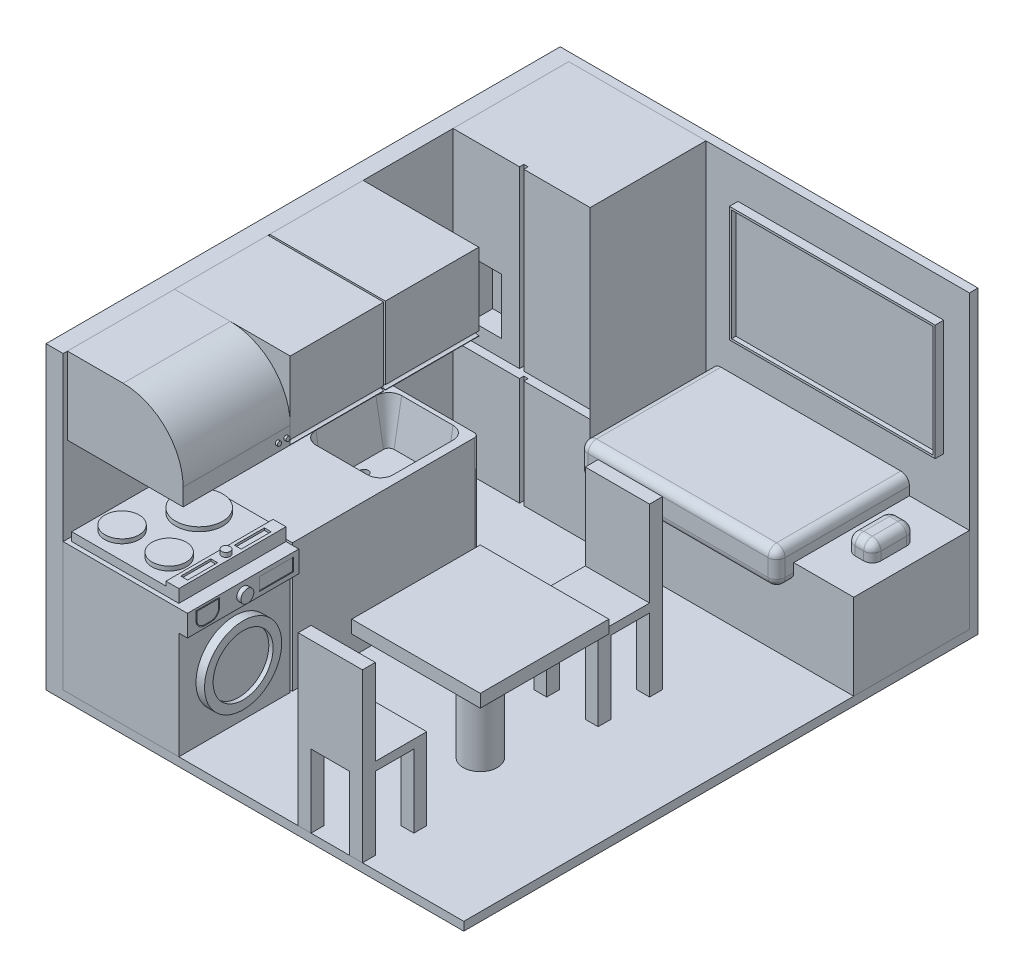
from build123d import *

# Parameters (mm, degrees)
SKETCH_2_W           = 97.5
SKETCH_2_H           = 120
EXTRUDE_2_DEPTH      = 2
SKETCH_3_W           = 97.5
SKETCH_3_H           = 2
EXTRUDE_3_DEPTH      = 68
SKETCH_7_W           = 4
SKETCH_7_H           = 118
EXTRUDE_6_DEPTH      = 68
SKETCH_8_W           = 30.5
SKETCH_8_H           = 30.5
CUT_EXTRUDE_1_DEPTH  = 2
SKETCH_9_W           = 27
SKETCH_9_H           = 70
EXTRUDE_7_DEPTH      = 30
SKETCH_10_W          = 25
SKETCH_10_H          = 25
EXTRUDE_8_DEPTH      = 2
SKETCH_11_W          = 3
SKETCH_11_H          = 25
EXTRUDE_9_DEPTH      = 1
SKETCH_12_R          = 4
SKETCH_12_R_2        = 5.5
EXTRUDE_10_DEPTH     = 1
SKETCH_13_R          = 1
EXTRUDE_11_DEPTH     = 1
SKETCH_14_W          = 1.6
SKETCH_14_H          = 7
CUT_EXTRUDE_2_DEPTH  = 0.5
CUT_EXTRUDE_3_DEPTH  = 10
CUT_EXTRUDE_3_DRAFT  = -10
SKETCH_16_R          = 1
CUT_EXTRUDE_4_DEPTH  = 10
SKETCH_18_R          = 1.25
EXTRUDE_15_DEPTH     = 1
SKETCH_24_R          = 1.25
SHELL_1_OUTLINE_R    = 0.75
SHELL_1_ANGLE        = 180
SHELL_START          = 32.5
SHELL_1_2_OUTLINE_R  = 0.75
SHELL_1_2_DEPTH      = 7.75
SKETCH_28_R          = 0.75
EXTRUDE_17_DEPTH     = 2
SKETCH_29_W          = 2
SKETCH_29_H          = 0.83835269
EXTRUDE_18_DEPTH     = 0.2
SKETCH_30_R          = 0.75
EXTRUDE_19_DEPTH     = 0.5
SKETCH_33_W          = 27
SKETCH_33_H          = 25
EXTRUDE_21_DEPTH     = 18
FILLET_3_R           = 14
SKETCH_34_R          = 0.5
EXTRUDE_22_DEPTH     = 0.5
SKETCH_35_W          = 27
SKETCH_35_H          = 44
EXTRUDE_23_DEPTH     = 18
CUT_EXTRUDE_6_DEPTH  = 44
SKETCH_37_W          = 0.4
SKETCH_37_H          = 18
CUT_EXTRUDE_10_DEPTH = 27
SKETCH_40_W          = 0.5
SKETCH_40_H          = 30
CUT_EXTRUDE_11_DEPTH = 27
SKETCH_41_R          = 9
EXTRUDE_25_DEPTH     = 2
SKETCH_42_R          = 7
CUT_EXTRUDE_12_DEPTH = 1
SKETCH_43_W          = 26
SKETCH_43_H          = 5
EXTRUDE_26_DEPTH     = 2
CUT_EXTRUDE_13_DEPTH = 1
SKETCH_45_R          = 1.5
EXTRUDE_27_DEPTH     = 1
SKETCH_46_W          = 7.948915111
SKETCH_46_H          = 3
CUT_EXTRUDE_14_DEPTH = 0.2
SKETCH_47_R          = 4
EXTRUDE_28_DEPTH     = 25
SKETCH_48_W          = 30
SKETCH_48_H          = 30
EXTRUDE_29_DEPTH     = 3
SKETCH_49_W          = 3
SKETCH_49_H          = 3
EXTRUDE_30_DEPTH     = 17
EXTRUDE_30_2_DEPTH   = 17
EXTRUDE_30_3_DEPTH   = 17
EXTRUDE_30_4_DEPTH   = 17
SKETCH_50_W          = 15
SKETCH_50_H          = 15
EXTRUDE_31_DEPTH     = 2
SKETCH_51_W          = 15
SKETCH_51_H          = 3
EXTRUDE_32_DEPTH     = 20
FILLET_4_R           = 1
SKETCH_53_W          = 60
SKETCH_53_H          = 27
EXTRUDE_33_DEPTH     = 20
SKETCH_54_W          = 6
SKETCH_54_H          = 10
EXTRUDE_34_DEPTH     = 4
FILLET_5_R           = 2
FILLET_6_R           = 2
FILLET_7_R           = 2
FILLET_8_R           = 2
SKETCH_55_W          = 46
SKETCH_55_H          = 31
EXTRUDE_35_DEPTH     = 4
SKETCH_56_W          = 46
SKETCH_56_H          = 4
EXTRUDE_36_DEPTH     = 4
FILLET_9_R           = 2
FILLET_10_R          = 2
FILLET_11_R          = 2
FILLET_12_R          = 2
SKETCH_57_W          = 48
SKETCH_57_H          = 27
EXTRUDE_37_DEPTH     = 2
SKETCH_58_W          = 47
SKETCH_58_H          = 26
CUT_EXTRUDE_15_DEPTH = 1
SKETCH_59_W          = 32
SKETCH_59_H          = 68
EXTRUDE_38_DEPTH     = 27
SKETCH_61_W          = 1
SKETCH_61_H          = 68
CUT_EXTRUDE_16_DEPTH = 1
SKETCH_64_W          = 31.9
SKETCH_64_H          = 2
CUT_EXTRUDE_23_DEPTH = 10
SKETCH_65_W          = 7
SKETCH_65_H          = 13
CUT_EXTRUDE_24_DEPTH = 5


with BuildPart() as part:
    # 스케치2 → 보스-돌출2 (new body)
    with BuildSketch(Plane(origin=(0, 0, 0), x_dir=(1, 0, 0), z_dir=(0, 1, 0))):
        Rectangle(SKETCH_2_W, SKETCH_2_H)
    extrude(amount=EXTRUDE_2_DEPTH)

    # 스케치3 → 보스-돌출3 (add)
    with BuildSketch(Plane(origin=(0, 2, 0), x_dir=(1, 0, 0), z_dir=(0, 1, 0))):
        with Locations((0, 59)):
            Rectangle(SKETCH_3_W, SKETCH_3_H)
    extrude(amount=EXTRUDE_3_DEPTH)

    # 스케치7 → 보스-돌출6 (add)
    with BuildSketch(Plane(origin=(0, 2, 0), x_dir=(1, 0, 0), z_dir=(0, 1, 0))):
        with Locations((-46.75, -1)):
            Rectangle(SKETCH_7_W, SKETCH_7_H)
    extrude(amount=EXTRUDE_6_DEPTH)

    # 스케치8 → 컷-돌출1 (cut)
    with BuildSketch(Plane.ZY.offset(48.75)):
        with Locations((0, 16.25)):
            Rectangle(SKETCH_8_W, SKETCH_8_H)
    extrude(amount=-CUT_EXTRUDE_1_DEPTH, mode=Mode.SUBTRACT)


with BuildPart() as body_2:
    # 스케치9 → 보스-돌출7 (new body)
    with BuildSketch(Plane(origin=(0, 2, 0), x_dir=(1, 0, 0), z_dir=(0, 1, 0))):
        with Locations((-31.25, -25)):
            Rectangle(SKETCH_9_W, SKETCH_9_H)
    extrude(amount=EXTRUDE_7_DEPTH)


with BuildPart() as body_3:
    # 스케치10 → 보스-돌출8 (new body)
    with BuildSketch(Plane(origin=(0, 32, 0), x_dir=(1, 0, 0), z_dir=(0, 1, 0))):
        with Locations((-31.25, -46.5)):
            Rectangle(SKETCH_10_W, SKETCH_10_H)
    extrude(amount=EXTRUDE_8_DEPTH)

    # 스케치11 → 보스-돌출9 (add)
    with BuildSketch(Plane(origin=(0, 34, 0), x_dir=(1, 0, 0), z_dir=(0, 1, 0))):
        with Locations((-20.25, -46.5)):
            Rectangle(SKETCH_11_W, SKETCH_11_H)
    extrude(amount=EXTRUDE_9_DEPTH)

    # 스케치12 → 보스-돌출10 (add)
    with BuildSketch(Plane(origin=(0, 34, 0), x_dir=(1, 0, 0), z_dir=(0, 1, 0))):
        with Locations(Location((-38.25, -52.75, 0), (0, 0, 270))):
            Circle(SKETCH_12_R)
        with Locations(Location((-27.25, -52.75, 0), (0, 0, 270))):
            Circle(SKETCH_12_R)
        with Locations(Location((-32.75, -40.25, 0), (0, 0, 270))):
            Circle(SKETCH_12_R_2)
    extrude(amount=EXTRUDE_10_DEPTH)

    # 스케치13 → 보스-돌출11 (add)
    with BuildSketch(Plane(origin=(0, 35, 0), x_dir=(1, 0, 0), z_dir=(0, 1, 0))):
        with Locations(Location((-20.25, -46.5, 0), (0, 0, 90))):
            Circle(SKETCH_13_R)
    extrude(amount=EXTRUDE_11_DEPTH)

    # 스케치14 → 컷-돌출2 (cut)
    with BuildSketch(Plane(origin=(0, 35, 0), x_dir=(1, 0, 0), z_dir=(0, 1, 0))):
        with Locations((-20.25, -52.75)):
            Rectangle(SKETCH_14_W, SKETCH_14_H)
        with Locations((-20.25, -40.25)):
            Rectangle(SKETCH_14_W, SKETCH_14_H)
    extrude(amount=-CUT_EXTRUDE_2_DEPTH, mode=Mode.SUBTRACT)


with BuildPart() as cut_extrude_3_tool:
    # 스케치15 → 컷-돌출3 (with draft: the straight prism first)
    with BuildSketch(Plane(origin=(0, 32, 0), x_dir=(1, 0, 0), z_dir=(0, 1, 0))):
        with BuildLine():
            Line((-34.75, -11), (-22.75, -11))
            ThreePointArc((-22.75, -11), (-20.628679656, -10.121320344), (-19.75, -8))
            Line((-19.75, -8), (-19.75, 6))
            ThreePointArc((-19.75, 6), (-20.628679656, 8.121320344), (-22.75, 9))
            Line((-22.75, 9), (-34.75, 9))
            ThreePointArc((-34.75, 9), (-36.871320344, 8.121320344), (-37.75, 6))
            Line((-37.75, 6), (-37.75, -8))
            ThreePointArc((-37.75, -8), (-36.871320344, -10.121320344), (-34.75, -11))
        make_face()
    extrude(amount=-CUT_EXTRUDE_3_DEPTH)
    # 컷-돌출3: the draft: its side faces are tilted about the plane it starts from
    cut_extrude_3_sides = [cut_extrude_3_tool.faces().sort_by_distance(p)[0] for p in [
        (-28.75, 27, 11),
        (-20.628679656, 27, 10.121320344),
        (-19.75, 27, 1),
        (-20.628679656, 27, -8.121320344),
        (-28.75, 27, -9),
        (-36.871320344, 27, -8.121320344),
        (-37.75, 27, 1),
        (-36.871320344, 27, 10.121320344),
    ]]
    draft(cut_extrude_3_sides, Plane(origin=(0, 32, 0), x_dir=(1, 0, 0), z_dir=(0, 1, 0)), CUT_EXTRUDE_3_DRAFT)


with BuildPart() as body_2_1:
    add(body_2.part)

    # 컷-돌출3: cut by cut_extrude_3_tool
    add(cut_extrude_3_tool.part, mode=Mode.SUBTRACT)

    # 스케치16 → 컷-돌출4 (cut)
    with BuildSketch(Plane(origin=(0, 22, 0), x_dir=(1, 0, 0), z_dir=(0, 1, 0))):
        with Locations(Location((-33.513269807, -1, 0), (0, 0, 270))):
            Circle(SKETCH_16_R)
    extrude(amount=-CUT_EXTRUDE_4_DEPTH, mode=Mode.SUBTRACT)

    # 스케치40 → 컷-돌출11 (cut)
    with BuildSketch(Plane(origin=(-17.75, 0, 0), x_dir=(0, 0, -1), z_dir=(1, 0, 0))):
        with Locations((-33.75, 17)):
            Rectangle(SKETCH_40_W, SKETCH_40_H)
    extrude(amount=-CUT_EXTRUDE_11_DEPTH, mode=Mode.SUBTRACT)


with BuildPart() as body_4:
    # 스케치18 → 보스-돌출15 (new body)
    with BuildSketch(Plane(origin=(0, 32, 0), x_dir=(1, 0, 0), z_dir=(0, 1, 0))):
        with Locations(Location((-42.75, -1, 0), (0, 0, 270))):
            Circle(SKETCH_18_R)
    extrude(amount=EXTRUDE_15_DEPTH)

    # 스윕2: sweep along a path in 스케치25
    with BuildLine(Plane(origin=(0, 0, 1), x_dir=(-1, 0, 0), z_dir=(0, 0, -1))) as sweep_2_path:
        Line((42.75, 33), (42.75, 40.25))
        ThreePointArc((42.75, 40.25), (37.75, 45.25), (32.75, 40.25))
    # 스케치24 → 스윕2 (sweep)
    with BuildSketch(Plane(origin=(0, 33, 0), x_dir=(1, 0, 0), z_dir=(0, 1, 0))):
        with Locations((-42.75, -1)):
            Circle(SKETCH_24_R)
    sweep(path=sweep_2_path.line)

    # 쉘1: read off the stored shape, not the designer's step
    # 쉘1 outline → 쉘1 (revolve, cut)
    with BuildSketch(Plane(origin=(-37.75, 40.25, 0), x_dir=(1, 0, 0), z_dir=(0, -1, 0))):
        with Locations((5, 1)):
            Circle(SHELL_1_OUTLINE_R)
    revolve(axis=Axis((-37.75, 40.25, 0), (0, 0, 1)), revolution_arc=SHELL_1_ANGLE, mode=Mode.SUBTRACT)

    # Shell 1 2 outline → Shell 1 2 (cut)
    with BuildSketch(Plane(origin=(0, 0, 0), x_dir=(1, 0, 0), z_dir=(0, 1, 0)).offset(SHELL_START)):
        with Locations((-42.75, -1)):
            Circle(SHELL_1_2_OUTLINE_R)
    extrude(amount=SHELL_1_2_DEPTH, mode=Mode.SUBTRACT)


with BuildPart() as body_5:
    # 스케치28 → 보스-돌출17 (new body)
    with BuildSketch(Plane(origin=(0, 32, 0), x_dir=(1, 0, 0), z_dir=(0, 1, 0))):
        with Locations(Location((-41.25, 4.25, 0), (0, 0, 270))):
            Circle(SKETCH_28_R)
    extrude(amount=EXTRUDE_17_DEPTH)

    # 스케치29 → 보스-돌출18 (add)
    with BuildSketch(Plane(origin=(0, 34, 0), x_dir=(1, 0, 0), z_dir=(0, 1, 0))):
        with Locations((-40.25, 4.25)):
            Rectangle(SKETCH_29_W, SKETCH_29_H)
    extrude(amount=EXTRUDE_18_DEPTH)

    # 스케치30 → 보스-돌출19 (add)
    with BuildSketch(Plane(origin=(0, 34, 0), x_dir=(1, 0, 0), z_dir=(0, 1, 0))):
        with Locations(Location((-41.25, 4.25, 0), (0, 0, 270))):
            Circle(SKETCH_30_R)
    extrude(amount=EXTRUDE_19_DEPTH)


with BuildPart() as body_6:
    # 스케치33 → 보스-돌출21 (new body)
    with BuildSketch(Plane(origin=(0, 52, 0), x_dir=(1, 0, 0), z_dir=(0, 1, 0))):
        with Locations((-31.25, -46.5)):
            Rectangle(SKETCH_33_W, SKETCH_33_H)
    extrude(amount=EXTRUDE_21_DEPTH)

    # 필렛3
    fillet_3_edges = [body_6.edges().sort_by_distance(p)[0] for p in [
        (-17.75, 70, 46.5),
    ]]
    fillet(fillet_3_edges, radius=FILLET_3_R)

    # 스케치34 → 보스-돌출22 (add)
    with BuildSketch(Plane(origin=(-17.75, 0, 0), x_dir=(0, 0, -1), z_dir=(1, 0, 0))):
        with Locations(Location((-35, 54, 0), (0, 0, 180))):
            Circle(SKETCH_34_R)
        with Locations(Location((-37, 54, 0), (0, 0, 180))):
            Circle(SKETCH_34_R)
    extrude(amount=EXTRUDE_22_DEPTH)


with BuildPart() as body_7:
    # 스케치35 → 보스-돌출23 (new body)
    with BuildSketch(Plane(origin=(0, 52, 0), x_dir=(1, 0, 0), z_dir=(0, 1, 0))):
        with Locations((-31.25, -12)):
            Rectangle(SKETCH_35_W, SKETCH_35_H)
    extrude(amount=EXTRUDE_23_DEPTH)

    # 스케치36 → 컷-돌출6 (cut)
    with BuildSketch(Plane(origin=(0, 0, -10), x_dir=(-1, 0, 0), z_dir=(0, 0, -1))):
        with BuildLine():
            Line((18.75, 53.1), (17.75, 53.1))
            Line((17.75, 53.1), (17.75, 52.1))
            ThreePointArc((17.75, 52.1), (18.457106781, 52.392893219), (18.75, 53.1))
        make_face()
    extrude(amount=-CUT_EXTRUDE_6_DEPTH, mode=Mode.SUBTRACT)

    # 스케치37 → 컷-돌출10 (cut)
    with BuildSketch(Plane(origin=(-17.75, 0, 0), x_dir=(0, 0, -1), z_dir=(1, 0, 0))):
        with Locations((-12, 61)):
            Rectangle(SKETCH_37_W, SKETCH_37_H)
    extrude(amount=-CUT_EXTRUDE_10_DEPTH, mode=Mode.SUBTRACT)


with BuildPart() as cut_extrude_10_piece_1:
    # of the separate pieces the step leaves, piece 1, a body of its own (cut_extrude_10_pieces)
    add(body_7.part.solids().sort_by_distance((-17.75, 52, -10))[0])


with BuildPart() as cut_extrude_10_piece_2:
    # of the separate pieces the step leaves, piece 2, a body of its own (cut_extrude_10_pieces)
    add(body_7.part.solids().sort_by_distance((-17.75, 52, 34))[0])


with BuildPart() as cut_extrude_11_piece_1:
    # of the separate pieces the step leaves, piece 1, a body of its own (cut_extrude_11_pieces)
    add(body_2_1.part.solids().sort_by_distance((-44.75, 2, -10))[0])

    # 필렛4
    fillet_4_edges = [cut_extrude_11_piece_1.edges().sort_by_distance(p)[0] for p in [
        (-17.75, 17, -10),
    ]]
    fillet(fillet_4_edges, radius=FILLET_4_R)


with BuildPart() as cut_extrude_11_piece_2:
    # of the separate pieces the step leaves, piece 2, a body of its own (cut_extrude_11_pieces)
    add(body_2_1.part.solids().sort_by_distance((-44.75, 2, 60))[0])

    # 스케치41 → 보스-돌출25 (add)
    with BuildSketch(Plane(origin=(-17.75, 0, 0), x_dir=(0, 0, -1), z_dir=(1, 0, 0))):
        with Locations((-47, 15)):
            Circle(SKETCH_41_R)
    extrude(amount=EXTRUDE_25_DEPTH)

    # 스케치42 → 컷-돌출12 (cut)
    with BuildSketch(Plane(origin=(-15.75, 0, 0), x_dir=(0, 0, -1), z_dir=(1, 0, 0))):
        with Locations((-47, 15)):
            Circle(SKETCH_42_R)
    extrude(amount=-CUT_EXTRUDE_12_DEPTH, mode=Mode.SUBTRACT)

    # 스케치43 → 보스-돌출26 (add)
    with BuildSketch(Plane(origin=(-17.75, 0, 0), x_dir=(0, 0, -1), z_dir=(1, 0, 0))):
        with Locations((-47, 29.5)):
            Rectangle(SKETCH_43_W, SKETCH_43_H)
    extrude(amount=EXTRUDE_26_DEPTH)

    # 스케치44 → 컷-돌출13 (cut)
    with BuildSketch(Plane(origin=(-15.75, 0, 0), x_dir=(0, 0, -1), z_dir=(1, 0, 0))):
        with BuildLine():
            Line((-58, 31.5), (-52.5, 31.5))
            Line((-52.5, 31.5), (-52.5, 29.5))
            ThreePointArc((-52.5, 29.5), (-53.085786438, 28.085786438), (-54.5, 27.5))
            Line((-54.5, 27.5), (-56, 27.5))
            ThreePointArc((-56, 27.5), (-57.414213562, 28.085786438), (-58, 29.5))
            Line((-58, 29.5), (-58, 31.5))
        make_face()
        with BuildLine():
            Line((-57.8, 31.3), (-52.7, 31.3))
            Line((-52.7, 31.3), (-52.7, 29.5))
            ThreePointArc((-52.7, 29.5), (-53.227207794, 28.227207794), (-54.5, 27.7))
            Line((-54.5, 27.7), (-56, 27.7))
            ThreePointArc((-56, 27.7), (-57.272792206, 28.227207794), (-57.8, 29.5))
            Line((-57.8, 29.5), (-57.8, 31.3))
        make_face(mode=Mode.SUBTRACT)
    extrude(amount=-CUT_EXTRUDE_13_DEPTH, mode=Mode.SUBTRACT)

    # 스케치45 → 보스-돌출27 (add)
    with BuildSketch(Plane(origin=(-15.75, 0, 0), x_dir=(0, 0, -1), z_dir=(1, 0, 0))):
        with Locations((-47, 29.5)):
            Circle(SKETCH_45_R)
    extrude(amount=EXTRUDE_27_DEPTH)

    # 스케치46 → 컷-돌출14 (cut)
    with BuildSketch(Plane(origin=(-15.75, 0, 0), x_dir=(0, 0, -1), z_dir=(1, 0, 0))):
        with Locations((-39.222820622, 29.5)):
            Rectangle(SKETCH_46_W, SKETCH_46_H)
    extrude(amount=-CUT_EXTRUDE_14_DEPTH, mode=Mode.SUBTRACT)


with BuildPart() as body_10:
    # 스케치47 → 보스-돌출28 (new body)
    with BuildSketch(Plane(origin=(0, 2, 0), x_dir=(1, 0, 0), z_dir=(0, 1, 0))):
        with Locations(Location((17.601601139, -25, 0), (0, 0, 270))):
            Circle(SKETCH_47_R)
    extrude(amount=EXTRUDE_28_DEPTH)

    # 스케치48 → 보스-돌출29 (add)
    with BuildSketch(Plane(origin=(0, 27, 0), x_dir=(1, 0, 0), z_dir=(0, 1, 0))):
        with Locations((17.601601139, -25)):
            Rectangle(SKETCH_48_W, SKETCH_48_H)
    extrude(amount=EXTRUDE_29_DEPTH)


with BuildPart() as body_11:
    # 스케치49 → 보스-돌출30 (new body)
    with BuildSketch(Plane(origin=(0, 2, 0), x_dir=(1, 0, 0), z_dir=(0, 1, 0))):
        with Locations((11.601601139, -46.5)):
            Rectangle(SKETCH_49_W, SKETCH_49_H)
    extrude(amount=EXTRUDE_30_DEPTH)



with BuildPart() as body_12:
    # 스케치49 → Extrude 30 2 (new body)
    with BuildSketch(Plane(origin=(0, 2, 0), x_dir=(1, 0, 0), z_dir=(0, 1, 0))):
        with Locations((23.601601139, -46.5)):
            Rectangle(SKETCH_49_W, SKETCH_49_H)
    extrude(amount=EXTRUDE_30_2_DEPTH)


with BuildPart() as body_13:
    # 스케치49 → Extrude 30 3 (new body)
    with BuildSketch(Plane(origin=(0, 2, 0), x_dir=(1, 0, 0), z_dir=(0, 1, 0))):
        with Locations((23.601601139, -58.5)):
            Rectangle(SKETCH_49_W, SKETCH_49_H)
    extrude(amount=EXTRUDE_30_3_DEPTH)


with BuildPart() as body_14:
    # 스케치49 → Extrude 30 4 (new body)
    with BuildSketch(Plane(origin=(0, 2, 0), x_dir=(1, 0, 0), z_dir=(0, 1, 0))):
        with Locations((11.601601139, -58.5)):
            Rectangle(SKETCH_49_W, SKETCH_49_H)
    extrude(amount=EXTRUDE_30_4_DEPTH)


with BuildPart() as body_11_1:
    add(body_11.part)

    add(body_12.part)  # 보스-돌출31 merges body 12

    add(body_13.part)  # 보스-돌출31 merges body 13

    add(body_14.part)  # 보스-돌출31 merges body 14
    # 스케치50 → 보스-돌출31 (add)
    with BuildSketch(Plane(origin=(0, 19, 0), x_dir=(1, 0, 0), z_dir=(0, 1, 0))):
        with Locations((17.601601139, -52.5)):
            Rectangle(SKETCH_50_W, SKETCH_50_H)
    extrude(amount=EXTRUDE_31_DEPTH)

    # 스케치51 → 보스-돌출32 (add)
    with BuildSketch(Plane(origin=(0, 21, 0), x_dir=(1, 0, 0), z_dir=(0, 1, 0))):
        with Locations((17.601601139, -58.5)):
            Rectangle(SKETCH_51_W, SKETCH_51_H)
    extrude(amount=EXTRUDE_32_DEPTH)


with BuildPart() as body_12_2:
    # 대칭 복사1: mirrored copy
    add(body_11_1.part.mirror(Plane.XY.offset(25)))


with BuildPart() as body_13_2:
    # 스케치53 → 보스-돌출33 (new body)
    with BuildSketch(Plane(origin=(0, 2, 0), x_dir=(1, 0, 0), z_dir=(0, 1, 0))):
        with Locations((18.75, 44.5)):
            Rectangle(SKETCH_53_W, SKETCH_53_H)
    extrude(amount=EXTRUDE_33_DEPTH)


with BuildPart() as body_14_2:
    # 스케치54 → 보스-돌출34 (new body)
    with BuildSketch(Plane(origin=(0, 22, 0), x_dir=(1, 0, 0), z_dir=(0, 1, 0))):
        with Locations((41.583180834, 44.5)):
            Rectangle(SKETCH_54_W, SKETCH_54_H)
    extrude(amount=EXTRUDE_34_DEPTH)

    # 필렛5
    fillet_5_edges = [body_14_2.edges().sort_by_distance(p)[0] for p in [
        (38.583180834, 26, -44.5),
    ]]
    fillet(fillet_5_edges, radius=FILLET_5_R)

    # 필렛6
    fillet_6_edges = [body_14_2.edges().sort_by_distance(p)[0] for p in [
        (44.583180834, 26, -44.5),
    ]]
    fillet(fillet_6_edges, radius=FILLET_6_R)

    # 필렛7
    fillet_7_edges = [body_14_2.edges().sort_by_distance(p)[0] for p in [
        (41.583180834, 26, -39.5),
        (38.583180834, 23, -39.5),
        (39.168967271, 25.414213562, -39.5),
        (44.583180834, 23, -39.5),
        (43.997394396, 25.414213562, -39.5),
    ]]
    fillet(fillet_7_edges, radius=FILLET_7_R)

    # 필렛8
    fillet_8_edges = [body_14_2.edges().sort_by_distance(p)[0] for p in [
        (38.583180834, 23, -49.5),
        (39.168967271, 25.414213562, -49.5),
        (41.583180834, 26, -49.5),
        (44.583180834, 23, -49.5),
        (43.997394396, 25.414213562, -49.5),
    ]]
    fillet(fillet_8_edges, radius=FILLET_8_R)


with BuildPart() as body_15:
    # 스케치55 → 보스-돌출35 (new body)
    with BuildSketch(Plane(origin=(0, 22, 0), x_dir=(1, 0, 0), z_dir=(0, 1, 0))):
        with Locations((11.75, 42.5)):
            Rectangle(SKETCH_55_W, SKETCH_55_H)
    extrude(amount=EXTRUDE_35_DEPTH)

    # 스케치56 → 보스-돌출36 (add)
    with BuildSketch(Plane.XZ.offset(-22)):
        with Locations((11.75, -29)):
            Rectangle(SKETCH_56_W, SKETCH_56_H)
    extrude(amount=EXTRUDE_36_DEPTH)

    # 필렛9
    fillet_9_edges = [body_15.edges().sort_by_distance(p)[0] for p in [
        (11.75, 26, -27),
    ]]
    fillet(fillet_9_edges, radius=FILLET_9_R)

    # 필렛10
    fillet_10_edges = [body_15.edges().sort_by_distance(p)[0] for p in [
        (11.75, 18, -27),
    ]]
    fillet(fillet_10_edges, radius=FILLET_10_R)

    # 필렛11
    fillet_11_edges = [body_15.edges().sort_by_distance(p)[0] for p in [
        (34.75, 18, -30),
        (34.75, 22, -27),
        (34.75, 26, -43.5),
        (34.75, 25.414213562, -27.585786438),
        (34.75, 18.585786438, -27.585786438),
    ]]
    fillet(fillet_11_edges, radius=FILLET_11_R)

    # 필렛12
    fillet_12_edges = [body_15.edges().sort_by_distance(p)[0] for p in [
        (-11.25, 22, -27),
        (-11.25, 25.414213562, -27.585786438),
        (-11.25, 18, -30),
        (-11.25, 18.585786438, -27.585786438),
        (-11.25, 26, -43.5),
    ]]
    fillet(fillet_12_edges, radius=FILLET_12_R)


with BuildPart() as body_16:
    # 스케치57 → 보스-돌출37 (new body)
    with BuildSketch(Plane.XY.offset(-58)):
        with Locations((18.75, 48)):
            Rectangle(SKETCH_57_W, SKETCH_57_H)
    extrude(amount=EXTRUDE_37_DEPTH)

    # 스케치58 → 컷-돌출15 (cut)
    with BuildSketch(Plane.XY.offset(-56)):
        with Locations((18.75, 48)):
            Rectangle(SKETCH_58_W, SKETCH_58_H)
    extrude(amount=-CUT_EXTRUDE_15_DEPTH, mode=Mode.SUBTRACT)


with BuildPart() as body_17:
    # 스케치59 → 보스-돌출38 (new body)
    with BuildSketch(Plane.XY.offset(-58)):
        with Locations((-28.75, 36)):
            Rectangle(SKETCH_59_W, SKETCH_59_H)
    extrude(amount=EXTRUDE_38_DEPTH)

    # 스케치61 → 컷-돌출16 (cut)
    with BuildSketch(Plane.XY.offset(-31)):
        with Locations((-28.75, 36)):
            Rectangle(SKETCH_61_W, SKETCH_61_H)
    extrude(amount=-CUT_EXTRUDE_16_DEPTH, mode=Mode.SUBTRACT)

    # 스케치64 → 컷-돌출23 (cut)
    with BuildSketch(Plane.XY.offset(-31)):
        with Locations((-28.8, 28.192416579)):
            Rectangle(SKETCH_64_W, SKETCH_64_H)
    extrude(amount=-CUT_EXTRUDE_23_DEPTH, mode=Mode.SUBTRACT)

    # 스케치65 → 컷-돌출24 (cut)
    with BuildSketch(Plane.XY.offset(-31)):
        with Locations((-37, 39.692416579)):
            Rectangle(SKETCH_65_W, SKETCH_65_H)
    extrude(amount=-CUT_EXTRUDE_24_DEPTH, mode=Mode.SUBTRACT)


solid = Compound([part.part, body_3.part, body_4.part, body_5.part, body_6.part, cut_extrude_10_piece_1.part, cut_extrude_10_piece_2.part, cut_extrude_11_piece_1.part, cut_extrude_11_piece_2.part, body_10.part, body_11_1.part, body_12_2.part, body_13_2.part, body_14_2.part, body_15.part, body_16.part, body_17.part])
